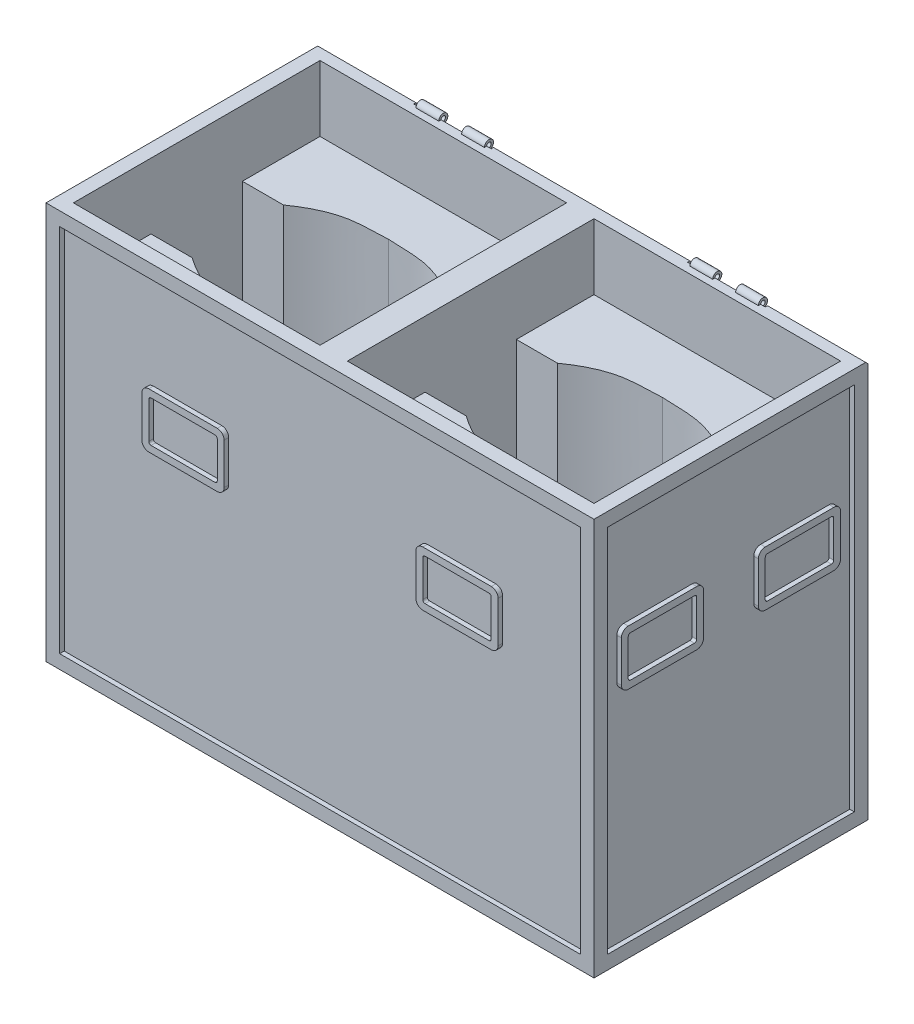
from build123d import *

# Parameters (mm, degrees)
SKETCH1_W                = 120
SKETCH1_H                = 60
BOSS_EXTRUDE1_DEPTH      = 87
SKETCH2_W                = 54
SKETCH2_H                = 54
CUT_EXTRUDE1_DEPTH       = 84
BOSS_EXTRUDE2_DEPTH      = 69.6
SKETCH6_R                = 5.05
CUT_EXTRUDE2_DEPTH       = 4
SKETCH7_W                = 114
SKETCH7_H                = 81
CUT_EXTRUDE3_DEPTH       = 1
CUT_EXTRUDE4_DEPTH       = 1
SKETCH9_W                = 54
SKETCH9_H                = 81
CUT_EXTRUDE5_DEPTH       = 1
SKETCH10_W               = 54
SKETCH10_H               = 81
CUT_EXTRUDE6_DEPTH       = 1
BOSS_EXTRUDE3_DEPTH      = 1
BOSS_EXTRUDE4_DEPTH      = 1
BOSS_EXTRUDE5_START      = 1
BOSS_EXTRUDE5_DEPTH      = 1
BOSS_EXTRUDE6_START      = 1
BOSS_EXTRUDE6_DEPTH      = 1
BOSS_EXTRUDE7_DEPTH      = 1
SKETCH17_W               = 17
SKETCH17_H               = 3
CUT_EXTRUDE8_DEPTH       = 1
SKETCH18_R               = 1
SKETCH18_R_2             = 0.5
BOSS_EXTRUDE8_DEPTH      = 17
SKETCH20_W               = 5
SKETCH20_H               = 2.821151354
SKETCH20_H_2             = 3.566987298
CUT_EXTRUDE9_DEPTH       = 17
SKETCH21_W               = 5
SKETCH21_H               = 3.39046935
CUT_EXTRUDE10_DEPTH      = 17
SKETCH22_W               = 1
SKETCH22_H               = 2.72076736
SKETCH22_H_2             = 0.900931798
CUT_EXTRUDE11_DEPTH      = 17
CUT_EXTRUDE12_DEPTH      = 161.078105936
CUT_EXTRUDE12_DEPTH_BACK = 161.078105936
SKETCH23_W               = 1
SKETCH23_H               = 1.612061383
SKETCH23_H_2             = 1
BOSS_EXTRUDE9_DEPTH      = 9
BOSS_EXTRUDE9_DEPTH_BACK = 4
SKETCH25_R               = 1
SKETCH25_R_2             = 0.5
SKETCH26_W               = 13
SKETCH26_H               = 0.366025404
BOSS_EXTRUDE10_DEPTH     = 0.5
SKETCH27_W               = 13
SKETCH27_H               = 0.5
BOSS_EXTRUDE11_DEPTH     = 0.5
BOSS_EXTRUDE16_START     = -14
SKETCH29_R               = 1
BOSS_EXTRUDE16_DEPTH     = 14
SKETCH30_R               = 0.5
CUT_EXTRUDE13_DEPTH      = 14
BOSS_EXTRUDE17_DEPTH     = 17
SKETCH32_W               = 1
SKETCH32_H               = 4.326205622
CUT_EXTRUDE14_DEPTH      = 17
CUT_EXTRUDE15_DEPTH      = 17
BOSS_EXTRUDE18_DEPTH     = 15
SKETCH37_W               = 5
SKETCH37_H               = 2.003114649
CUT_EXTRUDE16_DEPTH      = 15
CUT_EXTRUDE17_DEPTH      = 22
CUT_EXTRUDE18_DEPTH      = 43
CUT_EXTRUDE19_DEPTH      = 22
SKETCH43_W               = 15.13002209
SKETCH43_H               = 2.949847611
SKETCH43_W_2             = 13.702036237
SKETCH43_H_2             = 2.447500524
CUT_EXTRUDE21_DEPTH      = 1.5
SKETCH44_W               = 0.048317535
SKETCH44_H               = 2.487865731
SKETCH44_W_2             = 15.505571857
SKETCH44_H_2             = 3.029824386
SKETCH44_W_3             = 2.079291245
SKETCH44_H_3             = 7.307809552
CUT_EXTRUDE22_DEPTH      = 0.5


# Read off the part's stored shape, not the designer's step: Boss-Extrude3
with BuildPart() as part:
    # Sketch1 → Boss-Extrude1 (new body)
    with BuildSketch(Plane(origin=(0, 0, 0), x_dir=(1, 0, 0), z_dir=(0, 1, 0))):
        with Locations((60, 30)):
            Rectangle(SKETCH1_W, SKETCH1_H)
    extrude(amount=BOSS_EXTRUDE1_DEPTH)

    # Sketch2 → Cut-Extrude1 (cut)
    with BuildSketch(Plane(origin=(0, 87, 0), x_dir=(1, 0, 0), z_dir=(0, 1, 0))):
        with Locations((30, 30)):
            Rectangle(SKETCH2_W, SKETCH2_H)
        with Locations((90, 30)):
            Rectangle(SKETCH2_W, SKETCH2_H)
    extrude(amount=-CUT_EXTRUDE1_DEPTH, mode=Mode.SUBTRACT)

    # Sketch3 → Boss-Extrude2 (add)
    with BuildSketch(Plane(origin=(0, 3, 0), x_dir=(1, 0, 0), z_dir=(0, 1, 0))):
        with BuildLine():
            Line((17.053496774, 42.946503226), (3, 57))
            Line((3, 57), (3, 40))
            Line((3, 40), (12, 40))
            add(Edge.make_bspline(
                [(17.053496774, 42.946503226), (15.345381173, 42.176484913), (13.676373714, 41.178710465), (12, 40)],
                knots=[0.699831651, 0.699831651, 0.699831651, 0.699831651, 1, 1, 1, 1], degree=3))
        make_face()
        with BuildLine():
            Line((30, 57), (3, 57))
            Line((3, 57), (17.053496774, 42.946503226))
            add(Edge.make_bspline(
                [(30, 45), (26.976295953, 44.853943786), (22.501303631, 44.936432193), (18.444634915, 43.573628137), (17.053496774, 42.946503226)],
                knots=[0, 0, 0, 0, 0.455365973, 0.699831651, 0.699831651, 0.699831651, 0.699831651], degree=3))
            Line((30, 45), (30, 57))
        make_face()
        with BuildLine():
            Line((57, 57), (30, 57))
            Line((30, 57), (30, 45))
            add(Edge.make_bspline(
                [(30, 45), (33.023704047, 44.853943786), (39.41808806, 44.971812716), (44.958339644, 42.13868594), (48, 40)],
                knots=[0, 0, 0, 0, 0.455365973, 1, 1, 1, 1], degree=3))
            Line((48, 40), (57, 40))
            Line((57, 40), (57, 57))
        make_face()
        with BuildLine():
            Line((42.946503226, 17.053496774), (57, 3))
            Line((57, 3), (57, 20))
            Line((57, 20), (48, 20))
            add(Edge.make_bspline(
                [(42.946503226, 17.053496774), (44.654618827, 17.823515087), (46.323626286, 18.821289535), (48, 20)],
                knots=[0.699831651, 0.699831651, 0.699831651, 0.699831651, 1, 1, 1, 1], degree=3))
        make_face()
        with BuildLine():
            Line((12, 20), (3, 20))
            Line((3, 20), (3, 3))
            Line((3, 3), (57, 3))
            Line((57, 3), (42.946503226, 17.053496774))
            add(Edge.make_bspline(
                [(30, 15), (33.023704047, 15.146056214), (37.498696369, 15.063567807), (41.555365085, 16.426371863), (42.946503226, 17.053496774)],
                knots=[0, 0, 0, 0, 0.455365973, 0.699831651, 0.699831651, 0.699831651, 0.699831651], degree=3))
            add(Edge.make_bspline(
                [(30, 15), (26.976295953, 15.146056214), (20.58191194, 15.028187284), (15.041660356, 17.86131406), (12, 20)],
                knots=[0, 0, 0, 0, 0.455365973, 1, 1, 1, 1], degree=3))
        make_face()
        with BuildLine():
            Line((72, 20), (63, 20))
            Line((63, 20), (63, 3))
            Line((63, 3), (77.053496774, 17.053496774))
            add(Edge.make_bspline(
                [(77.053496774, 17.053496774), (75.345381173, 17.823515087), (73.676373714, 18.821289535), (72, 20)],
                knots=[0.699831651, 0.699831651, 0.699831651, 0.699831651, 1, 1, 1, 1], degree=3))
        make_face()
        with BuildLine():
            Line((117, 3), (117, 20))
            Line((117, 20), (108, 20))
            add(Edge.make_bspline(
                [(90, 15), (93.023704047, 15.146056214), (99.41808806, 15.028187284), (104.958339644, 17.86131406), (108, 20)],
                knots=[0, 0, 0, 0, 0.455365973, 1, 1, 1, 1], degree=3))
            add(Edge.make_bspline(
                [(90, 15), (86.976295953, 15.146056214), (82.501303631, 15.063567807), (78.444634915, 16.426371863), (77.053496774, 17.053496774)],
                knots=[0, 0, 0, 0, 0.455365973, 0.699831651, 0.699831651, 0.699831651, 0.699831651], degree=3))
            Line((77.053496774, 17.053496774), (63, 3))
            Line((63, 3), (117, 3))
        make_face()
        with BuildLine():
            Line((90, 57), (63, 57))
            Line((63, 57), (63, 40))
            Line((63, 40), (72, 40))
            add(Edge.make_bspline(
                [(90, 45), (86.976295953, 44.853943786), (80.58191194, 44.971812716), (75.041660356, 42.13868594), (72, 40)],
                knots=[0, 0, 0, 0, 0.455365973, 1, 1, 1, 1], degree=3))
            Line((90, 45), (90, 57))
        make_face()
        with BuildLine():
            Line((117, 57), (90, 57))
            Line((90, 57), (90, 45))
            add(Edge.make_bspline(
                [(90, 45), (93.023704047, 44.853943786), (97.498696369, 44.936432193), (101.555365085, 43.573628137), (102.946503226, 42.946503226)],
                knots=[0, 0, 0, 0, 0.455365973, 0.699831651, 0.699831651, 0.699831651, 0.699831651], degree=3))
            Line((102.946503226, 42.946503226), (117, 57))
        make_face()
        with BuildLine():
            Line((117, 40), (117, 57))
            Line((117, 57), (102.946503226, 42.946503226))
            add(Edge.make_bspline(
                [(102.946503226, 42.946503226), (104.654618827, 42.176484913), (106.323626286, 41.178710465), (108, 40)],
                knots=[0.699831651, 0.699831651, 0.699831651, 0.699831651, 1, 1, 1, 1], degree=3))
            Line((108, 40), (117, 40))
        make_face()
    extrude(amount=BOSS_EXTRUDE2_DEPTH)

    # Sketch6 → Cut-Extrude2 (cut)
    with BuildSketch(Plane.XZ):
        with Locations(Location((111, -51, 0), (0, 0, 270))):
            Circle(SKETCH6_R)
        with Locations(Location((9, -51, 0), (0, 0, 270))):
            Circle(SKETCH6_R)
        with Locations(Location((9, -9, 0), (0, 0, 270))):
            Circle(SKETCH6_R)
        with Locations(Location((111, -9, 0), (0, 0, 270))):
            Circle(SKETCH6_R)
    extrude(amount=-CUT_EXTRUDE2_DEPTH, mode=Mode.SUBTRACT)

    # Sketch7 → Cut-Extrude3 (cut)
    with BuildSketch(Plane.XY):
        with Locations((60, 43.5)):
            Rectangle(SKETCH7_W, SKETCH7_H)
    extrude(amount=-CUT_EXTRUDE3_DEPTH, mode=Mode.SUBTRACT)

    # Sketch8 → Cut-Extrude4 (cut)
    with BuildSketch(Plane(origin=(0, 0, -60), x_dir=(-1, 0, 0), z_dir=(0, 0, -1))):
        Polygon((-3, 84), (-117, 84), (-117, 83.763999698), (-117, 3), (-3, 3), align=None)
    extrude(amount=-CUT_EXTRUDE4_DEPTH, mode=Mode.SUBTRACT)

    # Sketch9 → Cut-Extrude5 (cut)
    with BuildSketch(Plane.ZY):
        with Locations((-30, 43.5)):
            Rectangle(SKETCH9_W, SKETCH9_H)
    extrude(amount=-CUT_EXTRUDE5_DEPTH, mode=Mode.SUBTRACT)

    # Sketch10 → Cut-Extrude6 (cut)
    with BuildSketch(Plane(origin=(120, 0, 0), x_dir=(0, 0, -1), z_dir=(1, 0, 0))):
        with Locations((30, 43.5)):
            Rectangle(SKETCH10_W, SKETCH10_H)
    extrude(amount=-CUT_EXTRUDE6_DEPTH, mode=Mode.SUBTRACT)

    # Boss-Extrude3 outline → Boss-Extrude3 (add)
    # profile 1 of 2: a face of its own
    with BuildSketch(Plane(origin=(0, 0, -59), x_dir=(-1, 0, 0), z_dir=(0, 0, -1))):
        with BuildLine():
            Line((-22.5, 63), (-37.5, 63))
            ThreePointArc((-37.5, 63), (-38.560660172, 62.560660172), (-39, 61.5))
            Line((-39, 61.5), (-39, 52.5))
            ThreePointArc((-39, 52.5), (-38.560660172, 51.439339828), (-37.5, 51))
            Line((-37.5, 51), (-22.5, 51))
            ThreePointArc((-22.5, 51), (-21.439339828, 51.439339828), (-21, 52.5))
            Line((-21, 52.5), (-21, 61.5))
            ThreePointArc((-21, 61.5), (-21.439339828, 62.560660172), (-22.5, 63))
        make_face()
        with BuildLine():
            ThreePointArc((-37, 52.5), (-37.353553391, 52.646446609), (-37.5, 53))
            Line((-37.5, 53), (-37.5, 61))
            ThreePointArc((-37.5, 61), (-37.353553391, 61.353553391), (-37, 61.5))
            Line((-37, 61.5), (-22.998496725, 61.49999774))
            ThreePointArc((-22.998496725, 61.49999774), (-22.64591552, 61.353021503), (-22.5, 61))
            Line((-22.5, 61), (-22.5, 53))
            ThreePointArc((-22.5, 53), (-22.646446609, 52.646446609), (-23, 52.5))
            Line((-23, 52.5), (-37, 52.5))
        make_face(mode=Mode.SUBTRACT)
    # profile 2 of 2: a face of its own
    with BuildSketch(Plane(origin=(0, 0, -59), x_dir=(-1, 0, 0), z_dir=(0, 0, -1))):
        with BuildLine():
            Line((-82.5, 63), (-97.5, 63))
            ThreePointArc((-97.5, 63), (-98.560660172, 62.560660172), (-99, 61.5))
            Line((-99, 61.5), (-99, 52.5))
            ThreePointArc((-99, 52.5), (-98.560660172, 51.439339828), (-97.5, 51))
            Line((-97.5, 51), (-82.5, 51))
            ThreePointArc((-82.5, 51), (-81.439339828, 51.439339828), (-81, 52.5))
            Line((-81, 52.5), (-81, 61.5))
            ThreePointArc((-81, 61.5), (-81.439339828, 62.560660172), (-82.5, 63))
        make_face()
        with BuildLine():
            ThreePointArc((-97.5, 61), (-97.35408448, 61.353021503), (-97.001503275, 61.49999774))
            Line((-97.001503275, 61.49999774), (-83, 61.5))
            ThreePointArc((-83, 61.5), (-82.646446609, 61.353553391), (-82.5, 61))
            Line((-82.5, 61), (-82.5, 53))
            ThreePointArc((-82.5, 53), (-82.646446609, 52.646446609), (-83, 52.5))
            Line((-83, 52.5), (-97, 52.5))
            ThreePointArc((-97, 52.5), (-97.353553391, 52.646446609), (-97.5, 53))
            Line((-97.5, 53), (-97.5, 61))
        make_face(mode=Mode.SUBTRACT)
    extrude(amount=BOSS_EXTRUDE3_DEPTH)

    # Sketch12 → Boss-Extrude4 (add)
    # profile 1 of 2: a face of its own
    with BuildSketch(Plane(origin=(119, 0, 0), x_dir=(0, 0, -1), z_dir=(1, 0, 0))):
        with BuildLine():
            Line((24, 52.5), (24, 61.5))
            ThreePointArc((24, 61.5), (23.560660172, 62.560660172), (22.5, 63))
            Line((22.5, 63), (7.5, 63))
            ThreePointArc((7.5, 63), (6.439339829, 62.560660172), (6, 61.500000002))
            Line((6, 61.500000002), (6, 52.5))
            ThreePointArc((6, 52.5), (6.439339828, 51.439339828), (7.5, 51))
            Line((7.5, 51), (22.5, 51))
            ThreePointArc((22.5, 51), (23.560660172, 51.439339828), (24, 52.5))
        make_face()
        with BuildLine():
            Line((8, 61.5), (22, 61.5))
            ThreePointArc((22, 61.5), (22.353553391, 61.353553391), (22.5, 61))
            Line((22.5, 61), (22.5, 53))
            ThreePointArc((22.5, 53), (22.353553391, 52.646446609), (22, 52.5))
            Line((22, 52.5), (8, 52.5))
            ThreePointArc((8, 52.5), (7.646446609, 52.646446609), (7.5, 53))
            Line((7.5, 53), (7.5, 61))
            ThreePointArc((7.5, 61), (7.646446609, 61.353553391), (8, 61.5))
        make_face(mode=Mode.SUBTRACT)
    # profile 2 of 2: a face of its own
    with BuildSketch(Plane(origin=(119, 0, 0), x_dir=(0, 0, -1), z_dir=(1, 0, 0))):
        with BuildLine():
            Line((54, 52.5), (54, 61.5))
            ThreePointArc((54, 61.5), (53.560660172, 62.560660172), (52.5, 63))
            Line((52.5, 63), (37.5, 63))
            ThreePointArc((37.5, 63), (36.439339822, 62.560660166), (36, 61.499999983))
            Line((36, 61.499999983), (36, 52.5))
            ThreePointArc((36, 52.5), (36.439339834, 51.439339822), (37.500000017, 51))
            Line((37.500000017, 51), (52.5, 51))
            ThreePointArc((52.5, 51), (53.560660172, 51.439339828), (54, 52.5))
        make_face()
        with BuildLine():
            ThreePointArc((37.5, 61), (37.646446609, 61.353553391), (38, 61.5))
            Line((38, 61.5), (52, 61.5))
            ThreePointArc((52, 61.5), (52.353553391, 61.353553391), (52.5, 61))
            Line((52.5, 61), (52.5, 53))
            ThreePointArc((52.5, 53), (52.353553391, 52.646446609), (52, 52.5))
            Line((52, 52.5), (38, 52.5))
            ThreePointArc((38, 52.5), (37.646446609, 52.646446609), (37.5, 53))
            Line((37.5, 53), (37.5, 61))
        make_face(mode=Mode.SUBTRACT)
    extrude(amount=BOSS_EXTRUDE4_DEPTH)

    # Sketch14 → Boss-Extrude5 (add)
    with BuildSketch(Plane.ZY.offset(-1).offset(BOSS_EXTRUDE5_START)):
        with BuildLine():
            ThreePointArc((-51, 61.5), (-51.439339828, 62.560660172), (-52.5, 63))
            ThreePointArc((-52.5, 63), (-53.560660178, 62.560660166), (-54, 61.499999983))
            ThreePointArc((-54, 61.499999983), (-53.560660166, 60.439339822), (-52.5, 60))
            Line((-52.5, 60), (-52.5, 61))
            Line((-52.5, 61), (-52.5, 61.5))
            Line((-52.5, 61.5), (-52, 61.5))
            Line((-52, 61.5), (-51, 61.5))
        make_face()
        with BuildLine():
            ThreePointArc((-52.5, 61), (-52.353553391, 61.353553391), (-52, 61.5))
            Line((-52, 61.5), (-52.5, 61.5))
            Line((-52.5, 61.5), (-52.5, 61))
        make_face()
        with BuildLine():
            ThreePointArc((-39, 61.5), (-38.560660172, 62.560660172), (-37.5, 63))
            Line((-37.5, 63), (-52.5, 63))
            ThreePointArc((-52.5, 63), (-51.439339828, 62.560660172), (-51, 61.5))
            Line((-51, 61.5), (-45, 61.5))
            Line((-45, 61.5), (-39, 61.5))
        make_face()
        with BuildLine():
            ThreePointArc((-37.5, 60), (-36.439339828, 60.439339828), (-36, 61.5))
            ThreePointArc((-36, 61.5), (-36.439339828, 62.560660172), (-37.5, 63))
            ThreePointArc((-37.5, 63), (-38.560660172, 62.560660172), (-39, 61.5))
            Line((-39, 61.5), (-38, 61.5))
            Line((-38, 61.5), (-37.5, 61.5))
            Line((-37.5, 61.5), (-37.5, 61))
            Line((-37.5, 61), (-37.5, 60))
        make_face()
        with BuildLine():
            ThreePointArc((-38, 61.5), (-37.646446609, 61.353553391), (-37.5, 61))
            Line((-37.5, 61), (-37.5, 61.5))
            Line((-37.5, 61.5), (-38, 61.5))
        make_face()
        with BuildLine():
            Line((-37.5, 57), (-36, 57))
            Line((-36, 57), (-36, 61.5))
            ThreePointArc((-36, 61.5), (-36.439339828, 60.439339828), (-37.5, 60))
            Line((-37.5, 60), (-37.5, 57))
        make_face()
        with BuildLine():
            Line((-36, 52.5), (-36, 57))
            Line((-36, 57), (-37.5, 57))
            Line((-37.5, 57), (-37.5, 54))
            ThreePointArc((-37.5, 54), (-36.439339828, 53.560660172), (-36, 52.5))
        make_face()
        with BuildLine():
            ThreePointArc((-37.5, 51), (-36.439339828, 51.439339828), (-36, 52.5))
            ThreePointArc((-36, 52.5), (-36.439339828, 53.560660172), (-37.5, 54))
            Line((-37.5, 54), (-37.5, 53))
            Line((-37.5, 53), (-37.5, 52.5))
            Line((-37.5, 52.5), (-38, 52.5))
            Line((-38, 52.5), (-39, 52.5))
            ThreePointArc((-39, 52.5), (-38.560660172, 51.439339828), (-37.5, 51))
        make_face()
        with BuildLine():
            Line((-45, 51), (-37.5, 51))
            ThreePointArc((-37.5, 51), (-38.560660172, 51.439339828), (-39, 52.5))
            Line((-39, 52.5), (-45, 52.5))
            Line((-45, 52.5), (-45, 51))
        make_face()
        with BuildLine():
            Line((-37.5, 52.5), (-37.5, 53))
            ThreePointArc((-37.5, 53), (-37.646446609, 52.646446609), (-38, 52.5))
            Line((-38, 52.5), (-37.5, 52.5))
        make_face()
        with BuildLine():
            Line((-45, 51), (-45, 52.5))
            Line((-45, 52.5), (-51, 52.5))
            ThreePointArc((-51, 52.5), (-51.439339828, 51.439339828), (-52.5, 51))
            Line((-52.5, 51), (-45, 51))
        make_face()
        with BuildLine():
            ThreePointArc((-52.5, 51), (-51.439339828, 51.439339828), (-51, 52.5))
            Line((-51, 52.5), (-52, 52.5))
            Line((-52, 52.5), (-52.5, 52.5))
            Line((-52.5, 52.5), (-52.5, 53))
            Line((-52.5, 53), (-52.5, 54))
            ThreePointArc((-52.5, 54), (-53.560660172, 53.560660172), (-54, 52.5))
            ThreePointArc((-54, 52.5), (-53.560660172, 51.439339828), (-52.5, 51))
        make_face()
        with BuildLine():
            ThreePointArc((-52.5, 60), (-53.560660166, 60.439339822), (-54, 61.499999983))
            Line((-54, 61.499999983), (-54, 52.5))
            ThreePointArc((-54, 52.5), (-53.560660172, 53.560660172), (-52.5, 54))
            Line((-52.5, 54), (-52.5, 60))
        make_face()
        with BuildLine():
            Line((-52.5, 52.5), (-52, 52.5))
            ThreePointArc((-52, 52.5), (-52.353553391, 52.646446609), (-52.5, 53))
            Line((-52.5, 53), (-52.5, 52.5))
        make_face()
        with BuildLine():
            Line((-7.5, 61), (-7.5, 61.5))
            Line((-7.5, 61.5), (-8, 61.5))
            ThreePointArc((-8, 61.5), (-7.646446609, 61.353553391), (-7.5, 61))
        make_face()
        with BuildLine():
            Line((-8, 61.5), (-7.5, 61.5))
            Line((-7.5, 61.5), (-7.5, 61))
            Line((-7.5, 61), (-7.5, 60))
            ThreePointArc((-7.5, 60), (-6.439339828, 60.439339828), (-6, 61.5))
            ThreePointArc((-6, 61.5), (-6.439339823, 62.560660167), (-7.499999986, 63))
            ThreePointArc((-7.499999986, 63), (-8.560660167, 62.560660177), (-9, 61.5))
            Line((-9, 61.5), (-8, 61.5))
        make_face()
        with BuildLine():
            Line((-15, 61.5), (-9, 61.5))
            ThreePointArc((-9, 61.5), (-8.560660167, 62.560660177), (-7.499999986, 63))
            Line((-7.499999986, 63), (-22.5, 63))
            ThreePointArc((-22.5, 63), (-21.439339828, 62.560660172), (-21, 61.5))
            Line((-21, 61.5), (-15, 61.5))
        make_face()
        with BuildLine():
            Line((-22, 61.5), (-21, 61.5))
            ThreePointArc((-21, 61.5), (-21.439339828, 62.560660172), (-22.5, 63))
            ThreePointArc((-22.5, 63), (-23.560660172, 62.560660172), (-24, 61.5))
            ThreePointArc((-24, 61.5), (-23.560660172, 60.439339828), (-22.5, 60))
            Line((-22.5, 60), (-22.5, 61))
            Line((-22.5, 61), (-22.5, 61.5))
            Line((-22.5, 61.5), (-22, 61.5))
        make_face()
        with BuildLine():
            ThreePointArc((-22.5, 61), (-22.353553391, 61.353553391), (-22, 61.5))
            Line((-22, 61.5), (-22.5, 61.5))
            Line((-22.5, 61.5), (-22.5, 61))
        make_face()
        with BuildLine():
            Line((-22.5, 54), (-22.5, 60))
            ThreePointArc((-22.5, 60), (-23.560660172, 60.439339828), (-24, 61.5))
            Line((-24, 61.5), (-24, 52.5))
            ThreePointArc((-24, 52.5), (-23.560660172, 53.560660172), (-22.5, 54))
        make_face()
        with BuildLine():
            Line((-22.5, 53), (-22.5, 54))
            ThreePointArc((-22.5, 54), (-23.560660172, 53.560660172), (-24, 52.5))
            ThreePointArc((-24, 52.5), (-23.560660172, 51.439339828), (-22.5, 51))
            ThreePointArc((-22.5, 51), (-21.439339828, 51.439339828), (-21, 52.5))
            Line((-21, 52.5), (-22, 52.5))
            Line((-22, 52.5), (-22.5, 52.5))
            Line((-22.5, 52.5), (-22.5, 53))
        make_face()
        with BuildLine():
            ThreePointArc((-22, 52.5), (-22.353553391, 52.646446609), (-22.5, 53))
            Line((-22.5, 53), (-22.5, 52.5))
            Line((-22.5, 52.5), (-22, 52.5))
        make_face()
        with BuildLine():
            Line((-15, 51), (-15, 52.5))
            Line((-15, 52.5), (-21, 52.5))
            ThreePointArc((-21, 52.5), (-21.439339828, 51.439339828), (-22.5, 51))
            Line((-22.5, 51), (-15, 51))
        make_face()
        with BuildLine():
            ThreePointArc((-7.5, 51), (-8.560660172, 51.439339828), (-9, 52.5))
            Line((-9, 52.5), (-15, 52.5))
            Line((-15, 52.5), (-15, 51))
            Line((-15, 51), (-7.5, 51))
        make_face()
        with BuildLine():
            ThreePointArc((-6, 52.5), (-6.439339828, 53.560660172), (-7.5, 54))
            Line((-7.5, 54), (-7.5, 53))
            Line((-7.5, 53), (-7.5, 52.5))
            Line((-7.5, 52.5), (-8, 52.5))
            Line((-8, 52.5), (-9, 52.5))
            ThreePointArc((-9, 52.5), (-8.560660172, 51.439339828), (-7.5, 51))
            ThreePointArc((-7.5, 51), (-6.439339828, 51.439339828), (-6, 52.5))
        make_face()
        with BuildLine():
            ThreePointArc((-6, 61.5), (-6.439339828, 60.439339828), (-7.5, 60))
            Line((-7.5, 60), (-7.5, 54))
            ThreePointArc((-7.5, 54), (-6.439339828, 53.560660172), (-6, 52.5))
            Line((-6, 52.5), (-6, 61.5))
        make_face()
        with BuildLine():
            Line((-7.5, 52.5), (-7.5, 53))
            ThreePointArc((-7.5, 53), (-7.646446609, 52.646446609), (-8, 52.5))
            Line((-8, 52.5), (-7.5, 52.5))
        make_face()
    extrude(amount=-BOSS_EXTRUDE5_DEPTH)

    # Sketch15 → Boss-Extrude6 (add)
    with BuildSketch(Plane.XY.offset(-1).offset(BOSS_EXTRUDE6_START)):
        with BuildLine():
            Line((21, 61.5), (21, 52.5))
            ThreePointArc((21, 52.5), (21.439339828, 53.560660172), (22.5, 54))
            Line((22.5, 54), (22.5, 60))
            ThreePointArc((22.5, 60), (21.439339828, 60.439339828), (21, 61.5))
        make_face()
        with BuildLine():
            ThreePointArc((21, 52.5), (21.439339828, 51.439339828), (22.5, 51))
            ThreePointArc((22.5, 51), (23.560660172, 51.439339828), (24, 52.5))
            Line((24, 52.5), (23, 52.5))
            Line((23, 52.5), (22.5, 52.5))
            Line((22.5, 52.5), (22.5, 53))
            Line((22.5, 53), (22.5, 54))
            ThreePointArc((22.5, 54), (21.439339828, 53.560660172), (21, 52.5))
        make_face()
        with BuildLine():
            Line((22.5, 51), (37.5, 51))
            ThreePointArc((37.5, 51), (36.439339828, 51.439339828), (36, 52.5))
            Line((36, 52.5), (24, 52.5))
            ThreePointArc((24, 52.5), (23.560660172, 51.439339828), (22.5, 51))
        make_face()
        with BuildLine():
            ThreePointArc((37.5, 51), (38.560660172, 51.439339828), (39, 52.5))
            ThreePointArc((39, 52.5), (38.560660172, 53.560660172), (37.5, 54))
            Line((37.5, 54), (37.5, 53))
            Line((37.5, 53), (37.5, 52.5))
            Line((37.5, 52.5), (37, 52.5))
            Line((37, 52.5), (36, 52.5))
            ThreePointArc((36, 52.5), (36.439339828, 51.439339828), (37.5, 51))
        make_face()
        with BuildLine():
            Line((39, 52.5), (39, 57))
            Line((39, 57), (37.5, 57))
            Line((37.5, 57), (37.5, 54))
            ThreePointArc((37.5, 54), (38.560660172, 53.560660172), (39, 52.5))
        make_face()
        with BuildLine():
            Line((37.5, 57), (39, 57))
            Line((39, 57), (39, 61.5))
            ThreePointArc((39, 61.5), (38.560660172, 60.439339828), (37.5, 60))
            Line((37.5, 60), (37.5, 57))
        make_face()
        with BuildLine():
            ThreePointArc((37.5, 60), (38.560660172, 60.439339828), (39, 61.5))
            ThreePointArc((39, 61.5), (38.560660172, 62.560660172), (37.5, 63))
            ThreePointArc((37.5, 63), (36.439339828, 62.560660172), (36, 61.5))
            Line((36, 61.5), (37, 61.5))
            Line((37, 61.5), (37.5, 61.5))
            Line((37.5, 61.5), (37.5, 61))
            Line((37.5, 61), (37.5, 60))
        make_face()
        with BuildLine():
            ThreePointArc((36, 61.5), (36.439339828, 62.560660172), (37.5, 63))
            Line((37.5, 63), (30, 63))
            Line((30, 63), (30, 61.5))
            Line((30, 61.5), (36, 61.5))
        make_face()
        with BuildLine():
            Line((24, 61.5), (30, 61.5))
            Line((30, 61.5), (30, 63))
            Line((30, 63), (22.5, 63))
            ThreePointArc((22.5, 63), (23.560660172, 62.560660172), (24, 61.5))
        make_face()
        with BuildLine():
            Line((23, 61.5), (24, 61.5))
            ThreePointArc((24, 61.5), (23.560660172, 62.560660172), (22.5, 63))
            ThreePointArc((22.5, 63), (21.439339828, 62.560660172), (21, 61.5))
            ThreePointArc((21, 61.5), (21.439339828, 60.439339828), (22.5, 60))
            Line((22.5, 60), (22.5, 61))
            Line((22.5, 61), (22.5, 61.5))
            Line((22.5, 61.5), (23, 61.5))
        make_face()
        with BuildLine():
            Line((22.5, 52.5), (23, 52.5))
            ThreePointArc((23, 52.5), (22.646446609, 52.646446609), (22.5, 53))
            Line((22.5, 53), (22.5, 52.5))
        make_face()
        with BuildLine():
            ThreePointArc((22.5, 61), (22.646446609, 61.353553391), (23, 61.5))
            Line((23, 61.5), (22.5, 61.5))
            Line((22.5, 61.5), (22.5, 61))
        make_face()
        with BuildLine():
            ThreePointArc((37, 61.5), (37.353553391, 61.353553391), (37.5, 61))
            Line((37.5, 61), (37.5, 61.5))
            Line((37.5, 61.5), (37, 61.5))
        make_face()
        with BuildLine():
            Line((37.5, 52.5), (37.5, 53))
            ThreePointArc((37.5, 53), (37.353553391, 52.646446609), (37, 52.5))
            Line((37, 52.5), (37.5, 52.5))
        make_face()
        with BuildLine():
            Line((83, 61.5), (84, 61.5))
            ThreePointArc((84, 61.5), (83.560660172, 62.560660172), (82.5, 63))
            ThreePointArc((82.5, 63), (81.439339828, 62.560660172), (81, 61.5))
            ThreePointArc((81, 61.5), (81.439339828, 60.439339828), (82.5, 60))
            Line((82.5, 60), (82.5, 61))
            Line((82.5, 61), (82.5, 61.5))
            Line((82.5, 61.5), (83, 61.5))
        make_face()
        with BuildLine():
            ThreePointArc((82.5, 61), (82.646446609, 61.353553391), (83, 61.5))
            Line((83, 61.5), (82.5, 61.5))
            Line((82.5, 61.5), (82.5, 61))
        make_face()
        with BuildLine():
            Line((84, 61.5), (90, 61.5))
            Line((90, 61.5), (90, 63))
            Line((90, 63), (82.5, 63))
            ThreePointArc((82.5, 63), (83.560660172, 62.560660172), (84, 61.5))
        make_face()
        with BuildLine():
            Line((82.5, 54), (82.5, 60))
            ThreePointArc((82.5, 60), (81.439339828, 60.439339828), (81, 61.5))
            Line((81, 61.5), (81, 52.5))
            ThreePointArc((81, 52.5), (81.439339828, 53.560660172), (82.5, 54))
        make_face()
        with BuildLine():
            Line((90, 61.5), (96, 61.5))
            ThreePointArc((96, 61.5), (96.439339828, 62.560660172), (97.5, 63))
            Line((97.5, 63), (90, 63))
            Line((90, 63), (90, 61.5))
        make_face()
        with BuildLine():
            Line((97, 61.5), (97.5, 61.5))
            Line((97.5, 61.5), (97.5, 61))
            Line((97.5, 61), (97.5, 60))
            ThreePointArc((97.5, 60), (98.560660172, 60.439339828), (99, 61.5))
            ThreePointArc((99, 61.5), (98.560660172, 62.560660172), (97.5, 63))
            ThreePointArc((97.5, 63), (96.439339828, 62.560660172), (96, 61.5))
            Line((96, 61.5), (97, 61.5))
        make_face()
        with BuildLine():
            Line((97.5, 61), (97.5, 61.5))
            Line((97.5, 61.5), (97, 61.5))
            ThreePointArc((97, 61.5), (97.353553391, 61.353553391), (97.5, 61))
        make_face()
        with BuildLine():
            ThreePointArc((99, 61.5), (98.560660172, 60.439339828), (97.5, 60))
            Line((97.5, 60), (97.5, 54))
            ThreePointArc((97.5, 54), (98.560660172, 53.560660172), (99, 52.5))
            Line((99, 52.5), (99, 61.5))
        make_face()
        with BuildLine():
            Line((97.5, 52.5), (97.5, 53))
            ThreePointArc((97.5, 53), (97.353553388, 52.646446607), (96.999999994, 52.5))
            Line((96.999999994, 52.5), (97.5, 52.5))
        make_face()
        with BuildLine():
            ThreePointArc((99, 52.5), (98.560660172, 53.560660172), (97.5, 54))
            Line((97.5, 54), (97.5, 53))
            Line((97.5, 53), (97.5, 52.5))
            Line((97.5, 52.5), (96.999999994, 52.5))
            Line((96.999999994, 52.5), (96, 52.5))
            ThreePointArc((96, 52.5), (96.439339828, 51.439339828), (97.5, 51))
            ThreePointArc((97.5, 51), (98.560660172, 51.439339828), (99, 52.5))
        make_face()
        with BuildLine():
            ThreePointArc((97.5, 51), (96.439339828, 51.439339828), (96, 52.5))
            Line((96, 52.5), (84, 52.5))
            ThreePointArc((84, 52.5), (83.560660166, 51.439339822), (82.499999983, 51))
            Line((82.499999983, 51), (97.5, 51))
        make_face()
        with BuildLine():
            Line((82.5, 52.5), (83, 52.5))
            ThreePointArc((83, 52.5), (82.646446609, 52.646446609), (82.5, 53))
            Line((82.5, 53), (82.5, 52.5))
        make_face()
        with BuildLine():
            ThreePointArc((82.499999983, 51), (83.560660166, 51.439339822), (84, 52.5))
            Line((84, 52.5), (83, 52.5))
            Line((83, 52.5), (82.5, 52.5))
            Line((82.5, 52.5), (82.5, 53))
            Line((82.5, 53), (82.5, 54))
            ThreePointArc((82.5, 54), (81.439339828, 53.560660172), (81, 52.5))
            ThreePointArc((81, 52.5), (81.439339822, 51.439339834), (82.499999983, 51))
        make_face()
    extrude(amount=-BOSS_EXTRUDE6_DEPTH)

    # Sketch16 → Boss-Extrude7 (add)
    with BuildSketch(Plane(origin=(0, 0, -59), x_dir=(-1, 0, 0), z_dir=(0, 0, -1))):
        with BuildLine():
            Line((-98.5, 77), (-81.5, 77))
            ThreePointArc((-81.5, 77), (-80.439339828, 77.439339828), (-80, 78.5))
            Line((-80, 78.5), (-80, 87))
            Line((-80, 87), (-81.5, 87))
            Line((-81.5, 87), (-81.5, 79))
            ThreePointArc((-81.5, 79), (-81.646446609, 78.646446609), (-82, 78.5))
            Line((-82, 78.5), (-98, 78.5))
            ThreePointArc((-98, 78.5), (-98.353553391, 78.646446609), (-98.5, 79))
            Line((-98.5, 79), (-98.5, 87))
            Line((-98.5, 87), (-100, 87))
            Line((-100, 87), (-100, 78.5))
            ThreePointArc((-100, 78.5), (-99.560660172, 77.439339828), (-98.5, 77))
        make_face()
        with BuildLine():
            ThreePointArc((-38, 78.5), (-38.353553391, 78.646446609), (-38.5, 79))
            Line((-38.5, 79), (-38.5, 87))
            Line((-38.5, 87), (-40, 87))
            Line((-40, 87), (-40, 78.5))
            ThreePointArc((-40, 78.5), (-39.560660172, 77.439339828), (-38.5, 77))
            Line((-38.5, 77), (-21.5, 77))
            ThreePointArc((-21.5, 77), (-20.439339828, 77.439339828), (-20, 78.5))
            Line((-20, 78.5), (-20, 87))
            Line((-20, 87), (-21.5, 87))
            Line((-21.5, 87), (-21.5, 79))
            ThreePointArc((-21.5, 79), (-21.646446609, 78.646446609), (-22, 78.5))
            Line((-22, 78.5), (-38, 78.5))
        make_face()
    extrude(amount=BOSS_EXTRUDE7_DEPTH)

    # Sketch17 → Cut-Extrude8 (cut)
    with BuildSketch(Plane(origin=(0, 0, -59), x_dir=(-1, 0, 0), z_dir=(0, 0, -1))):
        with Locations((-90, 85.5)):
            Rectangle(SKETCH17_W, SKETCH17_H)
        with Locations((-30, 85.5)):
            Rectangle(SKETCH17_W, SKETCH17_H)
    extrude(amount=CUT_EXTRUDE8_DEPTH, mode=Mode.SUBTRACT)

    # Sketch18 → Boss-Extrude8 (add)
    with BuildSketch(Plane.ZY.offset(-38.5)):
        with Locations((-59.5, 87)):
            Circle(SKETCH18_R)
        with Locations(Location((-59.5, 87, 0), (0, 0, 180))):
            Circle(SKETCH18_R_2, mode=Mode.SUBTRACT)
    extrude(amount=BOSS_EXTRUDE8_DEPTH)

    # Sketch20 → Cut-Extrude9 (cut)
    with BuildSketch(Plane(origin=(0, 0, -59), x_dir=(-1, 0, 0), z_dir=(0, 0, -1))):
        with Locations((-30, 87.544550273)):
            Rectangle(SKETCH20_W, SKETCH20_H)
        with Locations((-30, 84.350480947)):
            Rectangle(SKETCH20_W, SKETCH20_H_2)
    extrude(amount=CUT_EXTRUDE9_DEPTH, mode=Mode.SUBTRACT)

    # Sketch21 → Cut-Extrude10 (cut)
    with BuildSketch(Plane(origin=(0, 0, -59), x_dir=(-1, 0, 0), z_dir=(0, 0, -1))):
        with Locations((-30, 88.695234675)):
            Rectangle(SKETCH21_W, SKETCH21_H)
    extrude(amount=-CUT_EXTRUDE10_DEPTH, mode=Mode.SUBTRACT)

    # Sketch22 → Cut-Extrude11 (cut)
    with BuildSketch(Plane(origin=(0, 0, -59), x_dir=(-1, 0, 0), z_dir=(0, 0, -1))):
        with Locations((-38, 87.494358276)):
            Rectangle(SKETCH22_W, SKETCH22_H)
        with Locations((-38, 85.683508697)):
            Rectangle(SKETCH22_W, SKETCH22_H_2)
        with Locations((-22, 87.494358276)):
            Rectangle(SKETCH22_W, SKETCH22_H)
        with Locations((-22, 85.683508697)):
            Rectangle(SKETCH22_W, SKETCH22_H_2)
    extrude(amount=CUT_EXTRUDE11_DEPTH, mode=Mode.SUBTRACT)

    # Sketch23 → Cut-Extrude12 (cut, two sides: drawn at the far end of the back side and taken through both)
    with BuildSketch(Plane(origin=(0, 0, -59), x_dir=(-1, 0, 0), z_dir=(0, 0, -1)).offset(-CUT_EXTRUDE12_DEPTH_BACK)):
        with Locations((-38, 87.806030692)):
            Rectangle(SKETCH23_W, SKETCH23_H)
        with Locations((-22, 87.5)):
            Rectangle(SKETCH23_W, SKETCH23_H_2)
    extrude(amount=CUT_EXTRUDE12_DEPTH + CUT_EXTRUDE12_DEPTH_BACK, mode=Mode.SUBTRACT)

    # Sketch25 → Boss-Extrude9 (add, two sides: drawn at the far end of the back side and taken through both)
    with BuildSketch(Plane.ZY.offset(-32.5).offset(-BOSS_EXTRUDE9_DEPTH_BACK)):
        with Locations((-59.5, 79)):
            Circle(SKETCH25_R)
        with Locations((-59.5, 79)):
            Circle(SKETCH25_R_2, mode=Mode.SUBTRACT)
    extrude(amount=BOSS_EXTRUDE9_DEPTH + BOSS_EXTRUDE9_DEPTH_BACK)

    # Sketch26 → Boss-Extrude10 (add)
    with BuildSketch(Plane(origin=(0, 0, -60), x_dir=(-1, 0, 0), z_dir=(0, 0, -1))):
        with BuildLine():
            Line((-38.5, 79), (-38.5, 80))
            ThreePointArc((-38.5, 80), (-39.560660172, 79.560660172), (-40, 78.5))
            Line((-40, 78.5), (-38.5, 78.5))
            Line((-38.5, 78.5), (-38.5, 79))
        make_face()
        with BuildLine():
            Line((-38.5, 78.5), (-38.5, 77))
            ThreePointArc((-38.5, 77), (-39.560660172, 77.439339828), (-40, 78.5))
            Line((-40, 78.5), (-38.5, 78.5))
        make_face()
        with BuildLine():
            ThreePointArc((-38.5, 77), (-37.439339828, 77.439339828), (-37, 78.5))
            Line((-37, 78.5), (-38, 78.5))
            Line((-38, 78.5), (-38.5, 78.5))
            Line((-38.5, 78.5), (-38.5, 77))
        make_face()
        with BuildLine():
            Line((-36.5, 78.5), (-37, 78.5))
            ThreePointArc((-37, 78.5), (-37.439339828, 77.439339828), (-38.5, 77))
            Line((-38.5, 77), (-21.5, 77))
            ThreePointArc((-21.5, 77), (-22.560660172, 77.439339828), (-23, 78.5))
            Line((-23, 78.5), (-23.5, 78.5))
            Line((-23.5, 78.5), (-23.5, 78.133974596))
            Line((-23.5, 78.133974596), (-36.5, 78.133974596))
            Line((-36.5, 78.133974596), (-36.5, 78.5))
        make_face()
        with BuildLine():
            ThreePointArc((-38, 78.5), (-38.353553391, 78.646446609), (-38.5, 79))
            Line((-38.5, 79), (-38.5, 78.5))
            Line((-38.5, 78.5), (-38, 78.5))
        make_face()
        with BuildLine():
            Line((-38.5, 80), (-38.5, 87))
            Line((-38.5, 87), (-40, 87))
            Line((-40, 87), (-40, 84))
            Line((-40, 84), (-40, 78.5))
            ThreePointArc((-40, 78.5), (-39.560660172, 79.560660172), (-38.5, 80))
        make_face()
        with Locations((-30, 78.316987298)):
            Rectangle(SKETCH26_W, SKETCH26_H)
        with BuildLine():
            ThreePointArc((-23, 78.5), (-22.560660172, 77.439339828), (-21.5, 77))
            Line((-21.5, 77), (-21.5, 78.5))
            Line((-21.5, 78.5), (-22, 78.5))
            Line((-22, 78.5), (-23, 78.5))
        make_face()
        with BuildLine():
            Line((-21.5, 79), (-21.5, 78.5))
            Line((-21.5, 78.5), (-20, 78.5))
            ThreePointArc((-20, 78.5), (-20.439339828, 79.560660172), (-21.5, 80))
            Line((-21.5, 80), (-21.5, 79))
        make_face()
        with BuildLine():
            Line((-22, 78.5), (-21.5, 78.5))
            Line((-21.5, 78.5), (-21.5, 79))
            ThreePointArc((-21.5, 79), (-21.646446609, 78.646446609), (-22, 78.5))
        make_face()
        with BuildLine():
            Line((-21.5, 78.5), (-20, 78.5))
            ThreePointArc((-20, 78.5), (-20.439339828, 77.439339828), (-21.5, 77))
            Line((-21.5, 77), (-21.5, 78.5))
        make_face()
        with BuildLine():
            ThreePointArc((-21.5, 80), (-20.439339828, 79.560660172), (-20, 78.5))
            Line((-20, 78.5), (-20, 84))
            Line((-20, 84), (-20, 87))
            Line((-20, 87), (-21.5, 87))
            Line((-21.5, 87), (-21.5, 80))
        make_face()
        with BuildLine():
            Line((-100, 78.5), (-98.5, 78.5))
            Line((-98.5, 78.5), (-98.5, 79))
            Line((-98.5, 79), (-98.5, 80))
            ThreePointArc((-98.5, 80), (-99.560660172, 79.560660172), (-100, 78.5))
        make_face()
        with BuildLine():
            Line((-98.5, 78.5), (-98.5, 77))
            ThreePointArc((-98.5, 77), (-99.560660172, 77.439339828), (-100, 78.5))
            Line((-100, 78.5), (-98.5, 78.5))
        make_face()
        with BuildLine():
            Line((-98.5, 79), (-98.5, 78.5))
            Line((-98.5, 78.5), (-98, 78.5))
            ThreePointArc((-98, 78.5), (-98.353553391, 78.646446609), (-98.5, 79))
        make_face()
        with BuildLine():
            Line((-98.5, 78.5), (-98.5, 77))
            ThreePointArc((-98.5, 77), (-97.439339828, 77.439339828), (-97, 78.5))
            Line((-97, 78.5), (-98, 78.5))
            Line((-98, 78.5), (-98.5, 78.5))
        make_face()
        with BuildLine():
            Line((-98.5, 77), (-81.5, 77))
            ThreePointArc((-81.5, 77), (-82.560660172, 77.439339828), (-83, 78.5))
            Line((-83, 78.5), (-97, 78.5))
            ThreePointArc((-97, 78.5), (-97.439339828, 77.439339828), (-98.5, 77))
        make_face()
        with BuildLine():
            Line((-100, 84), (-100, 78.5))
            ThreePointArc((-100, 78.5), (-99.560660172, 79.560660172), (-98.5, 80))
            Line((-98.5, 80), (-98.5, 87))
            Line((-98.5, 87), (-100, 87))
            Line((-100, 87), (-100, 84))
        make_face()
        with BuildLine():
            Line((-81.5, 77), (-81.5, 78.5))
            Line((-81.5, 78.5), (-82, 78.5))
            Line((-82, 78.5), (-83, 78.5))
            ThreePointArc((-83, 78.5), (-82.560660172, 77.439339828), (-81.5, 77))
        make_face()
        with BuildLine():
            Line((-81.5, 78.5), (-80, 78.5))
            ThreePointArc((-80, 78.5), (-80.439339828, 79.560660172), (-81.5, 80))
            Line((-81.5, 80), (-81.5, 79))
            Line((-81.5, 79), (-81.5, 78.5))
        make_face()
        with BuildLine():
            Line((-81.5, 78.5), (-80, 78.5))
            ThreePointArc((-80, 78.5), (-80.439339828, 77.439339828), (-81.5, 77))
            Line((-81.5, 77), (-81.5, 78.5))
        make_face()
        with BuildLine():
            Line((-82, 78.5), (-81.5, 78.5))
            Line((-81.5, 78.5), (-81.5, 79))
            ThreePointArc((-81.5, 79), (-81.646446609, 78.646446609), (-82, 78.5))
        make_face()
        with BuildLine():
            Line((-80, 84), (-80, 87))
            Line((-80, 87), (-81.5, 87))
            Line((-81.5, 87), (-81.5, 80))
            ThreePointArc((-81.5, 80), (-80.439339828, 79.560660172), (-80, 78.5))
            Line((-80, 78.5), (-80, 84))
        make_face()
    extrude(amount=BOSS_EXTRUDE10_DEPTH)

    # Sketch27 → Boss-Extrude11 (add)
    with BuildSketch(Plane(origin=(0, 0, -60.5), x_dir=(-1, 0, 0), z_dir=(0, 0, -1))):
        with Locations((-30, 78.75)):
            Rectangle(SKETCH27_W, SKETCH27_H)
        with Locations((-90, 78.75)):
            Rectangle(SKETCH27_W, SKETCH27_H)
    extrude(amount=-BOSS_EXTRUDE11_DEPTH)

    # Sketch29 → Boss-Extrude16 (add)
    with BuildSketch(Plane.ZY.offset(-83.5).offset(BOSS_EXTRUDE16_START)):
        with Locations((-59.5, 79)):
            Circle(SKETCH29_R)
    extrude(amount=BOSS_EXTRUDE16_DEPTH)

    # Sketch30 → Cut-Extrude13 (cut)
    with BuildSketch(Plane.ZY.offset(-83.5)):
        with Locations((-59.5, 79)):
            Circle(SKETCH30_R)
    extrude(amount=-CUT_EXTRUDE13_DEPTH, mode=Mode.SUBTRACT)

    # Sketch31 → Boss-Extrude17 (add)
    with BuildSketch(Plane.ZY.offset(-98.5)):
        with BuildLine():
            Line((-59, 85.085786438), (-59, 86.133974596))
            ThreePointArc((-59, 86.133974596), (-59.630526192, 86.008555139), (-60.207106781, 86.292893219))
            Line((-60.207106781, 86.292893219), (-59, 85.085786438))
        make_face()
        with BuildLine():
            Line((-59, 86.133974596), (-59, 87))
            ThreePointArc((-59, 87), (-59.308658284, 86.538060234), (-59.853553391, 86.646446609))
            Line((-59.853553391, 86.646446609), (-60.207106781, 86.292893219))
            ThreePointArc((-60.207106781, 86.292893219), (-59.630526192, 86.008555139), (-59, 86.133974596))
        make_face()
        with BuildLine():
            ThreePointArc((-59.853553391, 86.646446609), (-59.961939766, 86.808658284), (-60, 87))
            Line((-60, 87), (-60.5, 87))
            ThreePointArc((-60.5, 87), (-60.423879533, 86.617316568), (-60.207106781, 86.292893219))
            Line((-60.207106781, 86.292893219), (-59.853553391, 86.646446609))
        make_face()
        with BuildLine():
            ThreePointArc((-60, 87), (-59.5, 87.5), (-59, 87))
            Line((-59, 87), (-59, 86.133974596))
            ThreePointArc((-59, 86.133974596), (-58.710500039, 86.38624939), (-58.537414057, 86.729023428))
            ThreePointArc((-58.537414057, 86.729023428), (-58.509397672, 86.86322636), (-58.5, 87))
            ThreePointArc((-58.5, 87), (-59.5, 88), (-60.5, 87))
            Line((-60.5, 87), (-60, 87))
        make_face()
    extrude(amount=BOSS_EXTRUDE17_DEPTH)

    # Sketch32 → Cut-Extrude14 (cut)
    with BuildSketch(Plane(origin=(0, 0, -59), x_dir=(-1, 0, 0), z_dir=(0, 0, -1))):
        with Locations((-98, 87.248889249)):
            Rectangle(SKETCH32_W, SKETCH32_H)
        Polygon((-92.5, 85.085786438), (-90, 85.085786438), (-87.5, 85.085786438), (-87.5, 88.292032819), (-90, 88.292032819), (-92.5, 88.292032819), align=None)
        with Locations((-82, 87.248889249)):
            Rectangle(SKETCH32_W, SKETCH32_H)
    extrude(amount=CUT_EXTRUDE14_DEPTH, mode=Mode.SUBTRACT)

    # Sketch34 → Cut-Extrude15 (cut)
    with BuildSketch(Plane(origin=(0, 0, -59), x_dir=(-1, 0, 0), z_dir=(0, 0, -1))):
        Polygon((-98.5, 87), (-97.5, 87), (-97.5, 89.153906649), (-98.943273218, 88.95372757), align=None)
        Polygon((-92.5, 87), (-87.5, 87), (-87.5, 88.806929578), (-92.5, 88.446607236), align=None)
        Polygon((-81.5, 87), (-82.5, 87), (-82.5, 88.446607236), (-80.37999996, 88.446607236), align=None)
    extrude(amount=-CUT_EXTRUDE15_DEPTH, mode=Mode.SUBTRACT)

    # Sketch36 → Boss-Extrude18 (add)
    with BuildSketch(Plane(origin=(37.5, 0, 0), x_dir=(0, 0, -1), z_dir=(1, 0, 0))):
        with BuildLine():
            Line((58.792893219, 84.878679656), (60.207106781, 86.292893219))
            ThreePointArc((60.207106781, 86.292893219), (59.630526192, 86.008555139), (59, 86.133974596))
            ThreePointArc((59, 86.133974596), (58.906240083, 86.195357744), (58.819937085, 86.266846243))
            Line((58.819937085, 86.266846243), (58.792893219, 84.878679656))
        make_face()
        with BuildLine():
            Line((60.207106781, 86.292893219), (59.853553391, 86.646446609))
            ThreePointArc((59.853553391, 86.646446609), (59.308658284, 86.538060234), (59, 87))
            Line((59, 87), (59, 86.133974596))
            ThreePointArc((59, 86.133974596), (59.630526192, 86.008555139), (60.207106781, 86.292893219))
        make_face()
    extrude(amount=-BOSS_EXTRUDE18_DEPTH)

    # Sketch37 → Cut-Extrude16 (cut)
    with BuildSketch(Plane(origin=(0, 0, -59), x_dir=(-1, 0, 0), z_dir=(0, 0, -1))):
        with Locations((-30, 85.998442676)):
            Rectangle(SKETCH37_W, SKETCH37_H)
    extrude(amount=CUT_EXTRUDE16_DEPTH, mode=Mode.SUBTRACT)

    # Sketch39 → Cut-Extrude17 (cut)
    with BuildSketch(Plane.ZY):
        Polygon((-59.5, 87), (-60, 87), (-60, 86.5), align=None)
        Polygon((-60, 86.5), (-60, 87), (-60.682853194, 87), (-60.682853194, 85.817146806), align=None)
    extrude(amount=-CUT_EXTRUDE17_DEPTH, mode=Mode.SUBTRACT)

    # Sketch40 → Cut-Extrude18 (cut)
    with BuildSketch(Plane.ZY.offset(-38.5)):
        Polygon((-60.5, 87), (-59.5, 87), (-60.5, 86), align=None)
    extrude(amount=-CUT_EXTRUDE18_DEPTH, mode=Mode.SUBTRACT)

    # Sketch41 → Cut-Extrude19 (cut)
    with BuildSketch(Plane(origin=(120, 0, 0), x_dir=(0, 0, -1), z_dir=(1, 0, 0))):
        Polygon((60, 87), (59.5, 87), (61.077388443, 85.422611557), (61.077388443, 87), align=None)
    extrude(amount=-CUT_EXTRUDE19_DEPTH, mode=Mode.SUBTRACT)

    # Sketch43 → Cut-Extrude21 (cut)
    with BuildSketch(Plane(origin=(0, 0, -60.5), x_dir=(-1, 0, 0), z_dir=(0, 0, -1))):
        with Locations((-90.434988955, 79.974923805)):
            Rectangle(SKETCH43_W, SKETCH43_H)
        with Locations((-30.351018119, 79.723750262)):
            Rectangle(SKETCH43_W_2, SKETCH43_H_2)
    extrude(amount=-CUT_EXTRUDE21_DEPTH, mode=Mode.SUBTRACT)

    # Sketch44 → Cut-Extrude22 (cut)
    with BuildSketch(Plane(origin=(0, 0, -60.5), x_dir=(-1, 0, 0), z_dir=(0, 0, -1))):
        Polygon((-97.951682465, 86.5), (-100.775607795, 86.5), (-100.775607795, 76.512134269), (-98, 76.512134269), (-98, 79), (-97.951682465, 79), align=None)
        Polygon((-82.224273515, 79), (-97.951682465, 79), (-97.951682465, 76.512134269), (-98, 76.512134269), (-98, 76.326620927), (-82.224273515, 76.326620927), align=None)
        with Locations((-97.975841233, 77.756067135)):
            Rectangle(SKETCH44_W, SKETCH44_H)
        Polygon((-82.224273515, 87.189457777), (-82.224273515, 79), (-82.224273515, 76.326620927), (-79.627086715, 76.326620927), (-79.627086715, 87.189457777), align=None)
        Polygon((-18.898501014, 76.662366062), (-18.898501014, 87.415272216), (-22.007536495, 87.415272216), (-22.007536495, 79.692190448), (-22.007536495, 76.662366062), align=None)
        with Locations((-29.760322423, 78.177278255)):
            Rectangle(SKETCH44_W_2, SKETCH44_H_2)
        Polygon((-37.513108352, 76.662366062), (-37.513108352, 79.692190448), (-38.285416529, 79.692190448), (-40.364707774, 79.692190448), (-40.364707774, 76.662366062), align=None)
        with Locations((-39.325062152, 83.346095224)):
            Rectangle(SKETCH44_W_3, SKETCH44_H_3)
    extrude(amount=-CUT_EXTRUDE22_DEPTH, mode=Mode.SUBTRACT)


solid = part.part
